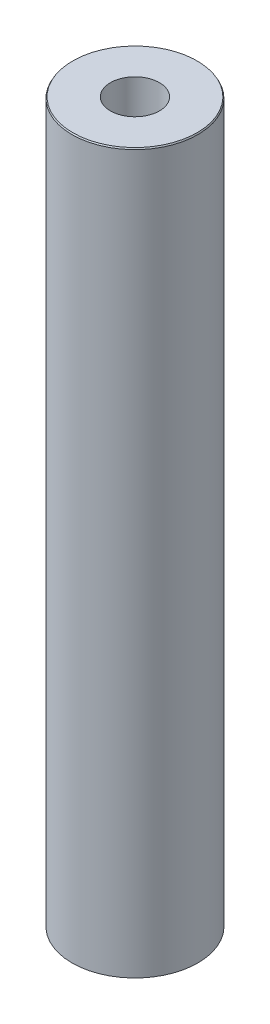
from build123d import *
from OCP.BRepFilletAPI import BRepFilletAPI_MakeChamfer

# Parameters (mm, degrees)
SKETCH1_R           = 52.5
BOSS_EXTRUDE1_DEPTH = 600
SKETCH2_R           = 20.440799584
CUT_EXTRUDE1_DEPTH  = 605.576297914
CHAMFER1_SIZE       = 1.076586558
CHAMFER1_SIZE2      = 0.621567539


with BuildPart() as part:
    # Sketch1 → Boss-Extrude1 (new body)
    with BuildSketch(Plane(origin=(0, 0, 0), x_dir=(1, 0, 0), z_dir=(0, 1, 0))):
        Circle(SKETCH1_R)
    extrude(amount=BOSS_EXTRUDE1_DEPTH)

    # Sketch2 → Cut-Extrude1 (cut, through all)
    with BuildSketch(Plane(origin=(0, 0, 0), x_dir=(1, 0, 0), z_dir=(0, 1, 0))):
        Circle(SKETCH2_R)
    extrude(amount=CUT_EXTRUDE1_DEPTH, mode=Mode.SUBTRACT)

    # Chamfer1: one chamfer whose edges measure the first distance from different faces: ONE call of the kernel's chamfer builder (chamfer() names one face for all edges)
    chamfer1_edges_1 = [part.edges().sort_by_distance(p)[0] for p in [
        (-52.5, 600, 0),
    ]]
    chamfer1_side_1 = [part.faces().sort_by_distance(p)[0] for p in [
        (-52.5, 300, 0),
    ]]
    chamfer1_edges_2 = [part.edges().sort_by_distance(p)[0] for p in [
        (-52.5, 0, 0),
    ]]
    chamfer1_side_2 = [part.faces().sort_by_distance(p)[0] for p in [
        (-51.01507576, 0, 0),
    ]]
    chamfer1 = BRepFilletAPI_MakeChamfer(part.part.solid().wrapped)
    for e in chamfer1_edges_1:
        chamfer1.Add(CHAMFER1_SIZE, CHAMFER1_SIZE2, e.wrapped, chamfer1_side_1[0].wrapped)  # the first distance lies on this face
    for e in chamfer1_edges_2:
        chamfer1.Add(CHAMFER1_SIZE, CHAMFER1_SIZE2, e.wrapped, chamfer1_side_2[0].wrapped)  # the first distance lies on this face
    add(Compound.cast(chamfer1.Shape()), mode=Mode.REPLACE)


solid = part.part
